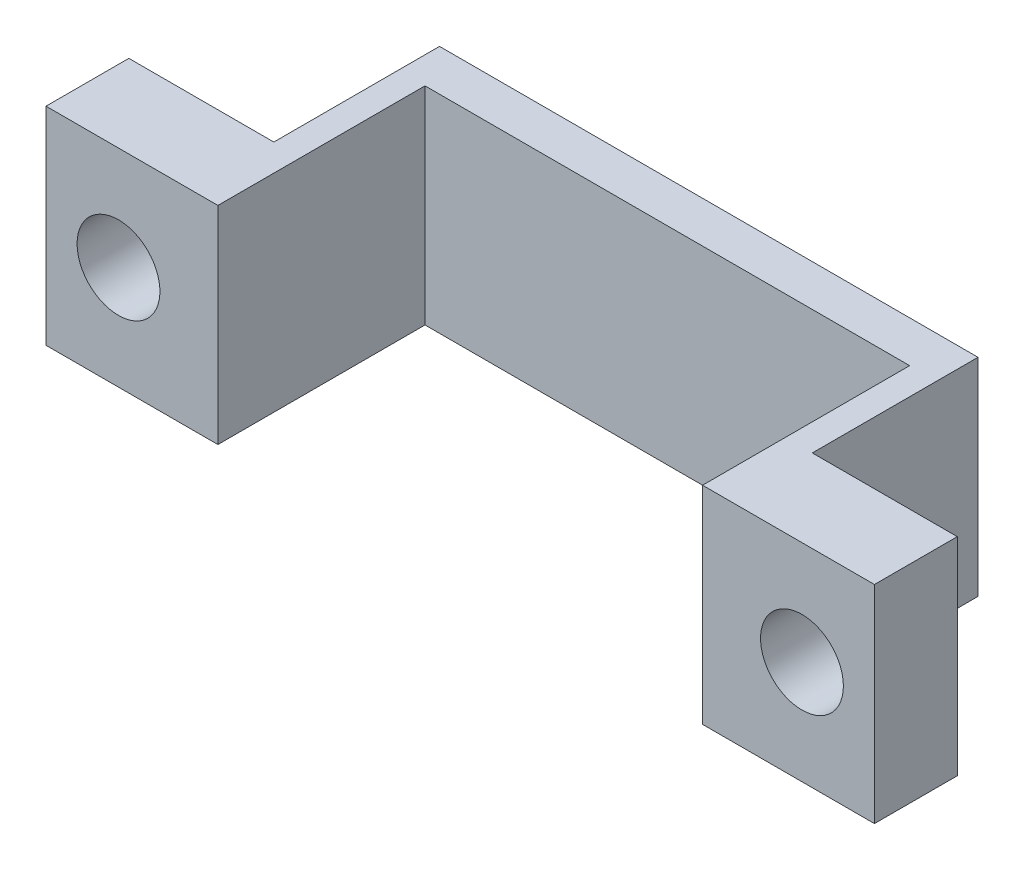
from build123d import *

# Parameters (mm, degrees)
EXTRUDE_1_DEPTH     = 10
SKETCH_3_R          = 2
CUT_EXTRUDE_2_DEPTH = 4


with BuildPart() as part:
    # Эскиз1 → Бобышка-Вытянуть1 (new body)
    with BuildSketch(Plane(origin=(0, 0, 0), x_dir=(1, 0, 0), z_dir=(0, 1, 0))):
        Polygon((-13, 2), (13, 2), (13, -6), (20, -6), (20, -10), (11.7, -10), (11.7, 0), (-11.7, 0), (-11.7, -10), (-20, -10), (-20, -6), (-13, -6), align=None)
    extrude(amount=EXTRUDE_1_DEPTH)

    # Эскиз3 → Вырез-Вытянуть2 (cut)
    with BuildSketch(Plane(origin=(0, 0, 6), x_dir=(-1, 0, 0), z_dir=(0, 0, -1))):
        with Locations((16.5, 5)):
            Circle(SKETCH_3_R)
    cut_extrude_2 = extrude(amount=-CUT_EXTRUDE_2_DEPTH, mode=Mode.SUBTRACT)

    # Зеркальное отражение1: Вырез-Вытянуть2 across plane
    add(cut_extrude_2.mirror(Plane.ZY), mode=Mode.SUBTRACT)


solid = part.part
